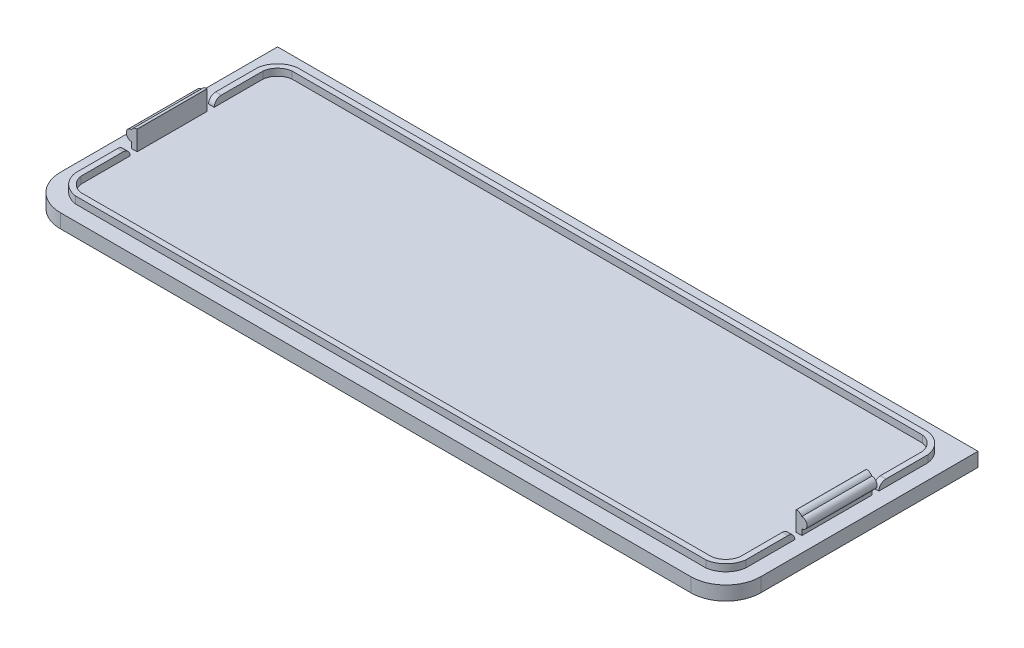
from build123d import *

# Parameters (mm, degrees)
EXTRUDE_2_DEPTH     = 2
EXTRUDE_4_DEPTH     = 1
SKETCH_7_W          = 0.8
SKETCH_7_H          = 10
EXTRUDE_8_DEPTH     = 2.8
SKETCH_8_R          = 0.75
EXTRUDE_9_DEPTH     = 10
FILLET_1_R          = 0.85
SKETCH_11_W         = 1
SKETCH_11_H         = 1
CUT_EXTRUDE_1_DEPTH = 1.2
FILLET_2_R          = 1
SKETCH_13_W         = 0.8
SKETCH_13_H         = 10
EXTRUDE_10_DEPTH    = 1.8
SKETCH_14_R         = 0.75
EXTRUDE_11_DEPTH    = 10
FILLET_3_R          = 0.85
SKETCH_15_W         = 0.8
SKETCH_15_H         = 1
CUT_EXTRUDE_3_DEPTH = 1
FILLET_4_R          = 1


# Some blends are built 0.0001 mm under size
with BuildPart() as part:
    # case 2 → 凸台-拉伸2 (new body)
    with BuildSketch(Plane(origin=(0, 0, 0), x_dir=(1, 0, 0), z_dir=(0, 1, 0))):
        with BuildLine():
            Line((-51.542196447, 13), (-51.542196447, 18))
            Line((-51.542196447, 18), (-46.542196447, 18))
            Line((-46.542196447, 18), (43.457803553, 18))
            Line((43.457803553, 18), (48.457803553, 18))
            Line((48.457803553, 18), (48.457803553, 13))
            Line((48.457803553, 13), (48.457803553, -13))
            ThreePointArc((48.457803553, -13), (46.993337459, -16.535533906), (43.457803553, -18))
            Line((43.457803553, -18), (-46.542196447, -18))
            ThreePointArc((-46.542196447, -18), (-50.077730353, -16.535533906), (-51.542196447, -13))
            Line((-51.542196447, -13), (-51.542196447, 13))
        make_face()
    extrude(amount=EXTRUDE_2_DEPTH)

    # 草图3 → 凸台-拉伸4 (add)
    with BuildSketch(Plane(origin=(0, 2, 0), x_dir=(1, 0, 0), z_dir=(0, 1, 0))):
        with BuildLine():
            Line((-49.392196447, 13), (-49.392196447, -13))
            ThreePointArc((-49.392196447, -13), (-48.452846076, -14.910649629), (-46.542196447, -15.85))
            Line((-46.542196447, -15.85), (43.457803553, -15.85))
            ThreePointArc((43.457803553, -15.85), (45.368453181, -14.910649629), (46.307803553, -13))
            Line((46.307803553, -13), (46.307803553, 13))
            ThreePointArc((46.307803553, 13), (45.368453181, 14.910649629), (43.457803553, 15.85))
            Line((43.457803553, 15.85), (-46.542196447, 15.85))
            ThreePointArc((-46.542196447, 15.85), (-48.452846076, 14.910649629), (-49.392196447, 13))
        make_face()
        with BuildLine():
            Line((-46.542196447, -15.05), (43.457803553, -15.05))
            ThreePointArc((43.457803553, -15.05), (44.827315928, -14.369512375), (45.507803553, -13))
            Line((45.507803553, -13), (45.507803553, 13))
            ThreePointArc((45.507803553, 13), (44.827315928, 14.369512375), (43.457803553, 15.05))
            Line((43.457803553, 15.05), (-46.542196447, 15.05))
            ThreePointArc((-46.542196447, 15.05), (-47.911708823, 14.369512375), (-48.592196447, 13))
            Line((-48.592196447, 13), (-48.592196447, -13))
            ThreePointArc((-48.592196447, -13), (-47.911708823, -14.369512375), (-46.542196447, -15.05))
        make_face(mode=Mode.SUBTRACT)
    extrude(amount=EXTRUDE_4_DEPTH)

    # 草图7 → 凸台-拉伸8 (add)
    with BuildSketch(Plane(origin=(0, 2, 0), x_dir=(1, 0, 0), z_dir=(0, 1, 0))):
        with Locations((-48.992196447, 0)):
            Rectangle(SKETCH_7_W, SKETCH_7_H)
    extrude(amount=EXTRUDE_8_DEPTH)

    # 草图8 → 凸台-拉伸9 (add)
    with BuildSketch(Plane.XY.offset(5)):
        with Locations((-49.392196447, 3.6)):
            Circle(SKETCH_8_R)
    extrude(amount=-EXTRUDE_9_DEPTH)

    # 圆角1
    # the kernel refuses this fillet: 0.85 mm, written as the material it takes off along each edge
    with BuildSketch(Plane(origin=(-49.392196447, 4.8, 6.875), x_dir=(0, -1, 0), z_dir=(0, 0, -1))) as fillet_1_piece_1:
        with BuildLine():
            CenterArc((0.85, -0.75), FILLET_1_R, 118.072486936, 61.927513064)
            Line((0, -0.75), (-0.017, -0.75))
            Line((-0.017, -0.75), (-0.017, 0))
            Line((-0.017, 0), (0, 0.017))
            ThreePointArc((0, 0.017), (0.225, 0.017), (0.442, 0.015))
            Line((0.442, 0.015), (0.45, 0))
        make_face()
    extrude(amount=13.75, mode=Mode.SUBTRACT)

    # 草图11 → 切除-拉伸1 (cut)
    with BuildSketch(Plane.ZY.offset(49.392196447)):
        with Locations((5.5, 2.5)):
            Rectangle(SKETCH_11_W, SKETCH_11_H)
        with Locations((-5.5, 2.5)):
            Rectangle(SKETCH_11_W, SKETCH_11_H)
    extrude(amount=-CUT_EXTRUDE_1_DEPTH, mode=Mode.SUBTRACT)

    # 圆角2
    fillet_2_edges = [part.edges().sort_by_distance(p)[0] for p in [
        (-48.992196447, 3, 6),
        (-48.992196447, 3, -6),
    ]]
    fillet(fillet_2_edges, radius=FILLET_2_R - 0.0001)  # a hair under: the kernel refuses the full size

    # 草图13 → 凸台-拉伸10 (add)
    with BuildSketch(Plane(origin=(0, 3, 0), x_dir=(1, 0, 0), z_dir=(0, 1, 0))):
        with Locations((45.907803553, 0)):
            Rectangle(SKETCH_13_W, SKETCH_13_H)
    extrude(amount=EXTRUDE_10_DEPTH)

    # 草图14 → 凸台-拉伸11 (add)
    with BuildSketch(Plane.XY.offset(5)):
        with Locations((46.307803553, 3.6)):
            Circle(SKETCH_14_R)
    extrude(amount=-EXTRUDE_11_DEPTH)

    # 圆角3
    # the kernel refuses this fillet: 0.85 mm, written as the material it takes off along each edge
    with BuildSketch(Plane(origin=(46.307803553, 4.8, -6.875), x_dir=(0, -1, 0), z_dir=(0, 0, 1))) as fillet_3_piece_1:
        with BuildLine():
            CenterArc((0.85, -0.75), FILLET_3_R, 118.072486936, 61.927513064)
            Line((0, -0.75), (-0.017, -0.75))
            Line((-0.017, -0.75), (-0.017, 0))
            Line((-0.017, 0), (0, 0.017))
            ThreePointArc((0, 0.017), (0.225, 0.017), (0.442, 0.015))
            Line((0.442, 0.015), (0.45, 0))
        make_face()
    extrude(amount=13.75, mode=Mode.SUBTRACT)

    # 草图15 → 切除-拉伸3 (cut)
    with BuildSketch(Plane(origin=(0, 3, 0), x_dir=(1, 0, 0), z_dir=(0, 1, 0))):
        with Locations((45.907803553, 5.5)):
            Rectangle(SKETCH_15_W, SKETCH_15_H)
        with Locations((45.907803553, -5.5)):
            Rectangle(SKETCH_15_W, SKETCH_15_H)
    extrude(amount=-CUT_EXTRUDE_3_DEPTH, mode=Mode.SUBTRACT)

    # 圆角4
    fillet_4_edges = [part.edges().sort_by_distance(p)[0] for p in [
        (45.907803553, 3, 6),
        (45.907803553, 3, -6),
    ]]
    fillet(fillet_4_edges, radius=FILLET_4_R - 0.0001)  # a hair under: the kernel refuses the full size


solid = part.part
